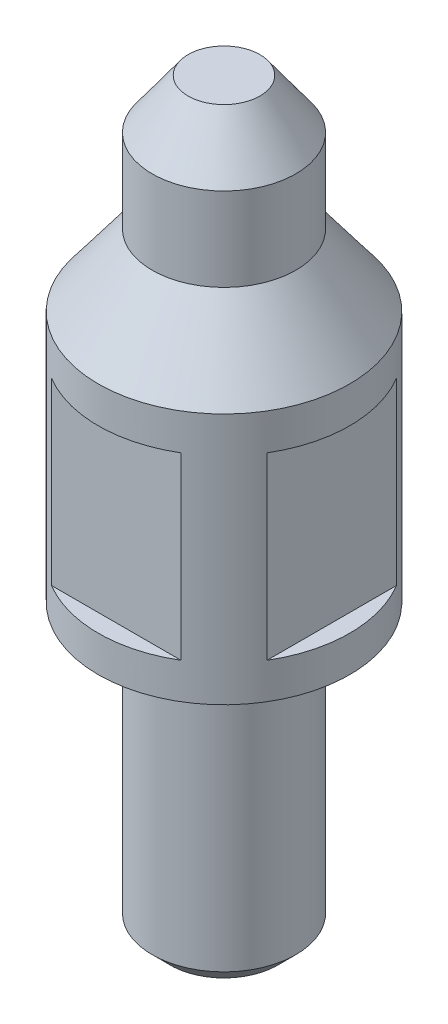
from build123d import *

# Parameters (mm, degrees)
SKETCH2_W          = 0.5
SKETCH2_H          = 5
CUT_EXTRUDE1_DEPTH = 14.630480549
CIRPATTERN1_COUNT  = 2
CIRPATTERN1_ANGLE  = 90
CHAMFER1_SIZE2     = 1.5
CHAMFER1_SIZE      = 1.990567232
CHAMFER2_SIZE      = 1
CHAMFER2_SIZE2     = 1.37638192
CHAMFER3_SIZE      = 0.5


with BuildPart() as part:
    # Sketch1 → Revolve1 (revolve)
    with BuildSketch(Plane.XY, mode=Mode.PRIVATE) as revolve1_sk:
        Polygon((0, -8), (2, -8), (2, 0), (3.5, 0), (3.5, 9), (2, 9), (2, 12.7), (0, 12.7), align=None)
    revolve(revolve1_sk.sketch.rotate(Axis((0, -11.082621068, 0), (0, 1, 0)), 90), axis=Axis((0, -11.082621068, 0), (0, 1, 0)))

    # Sketch2 → Cut-Extrude1 (cut, symmetric)
    with BuildSketch(Plane.XY):
        with Locations((-3.25, 3.5)):
            Rectangle(SKETCH2_W, SKETCH2_H)
        with Locations((3.25, 3.5)):
            Rectangle(SKETCH2_W, SKETCH2_H)
    cut_extrude1 = extrude(amount=CUT_EXTRUDE1_DEPTH, both=True, mode=Mode.SUBTRACT)

    # CirPattern1: Cut-Extrude1 ×2 about axis
    cirpattern1_axis = Axis((0, -11.082621068, 0), (0, -1, 0))
    for i in range(1, CIRPATTERN1_COUNT):
        add(cut_extrude1.rotate(cirpattern1_axis, i * CIRPATTERN1_ANGLE / (CIRPATTERN1_COUNT - 1)), mode=Mode.SUBTRACT)

    # Chamfer1
    chamfer1_edges = [part.edges().sort_by_distance(p)[0] for p in [
        (0, 9, 3.5),
    ]]
    chamfer1_side = [part.faces().sort_by_distance(p)[0] for p in [
        (0, 8.97, 3.5),
    ]]
    chamfer(chamfer1_edges, length=CHAMFER1_SIZE - 0.0001, length2=CHAMFER1_SIZE2 - 0.0001, reference=chamfer1_side[0])  # a hair under: the kernel refuses the full size

    # Chamfer2
    chamfer2_edges = [part.edges().sort_by_distance(p)[0] for p in [
        (0, 12.7, 2),
    ]]
    chamfer2_side = [part.faces().sort_by_distance(p)[0] for p in [
        (0, 12.7, 0),
    ]]
    chamfer(chamfer2_edges, length=CHAMFER2_SIZE, length2=CHAMFER2_SIZE2, reference=chamfer2_side[0])

    # Chamfer3
    chamfer3_edges = [part.edges().sort_by_distance(p)[0] for p in [
        (0, -8, 2),
    ]]
    chamfer(chamfer3_edges, length=CHAMFER3_SIZE)


solid = part.part
